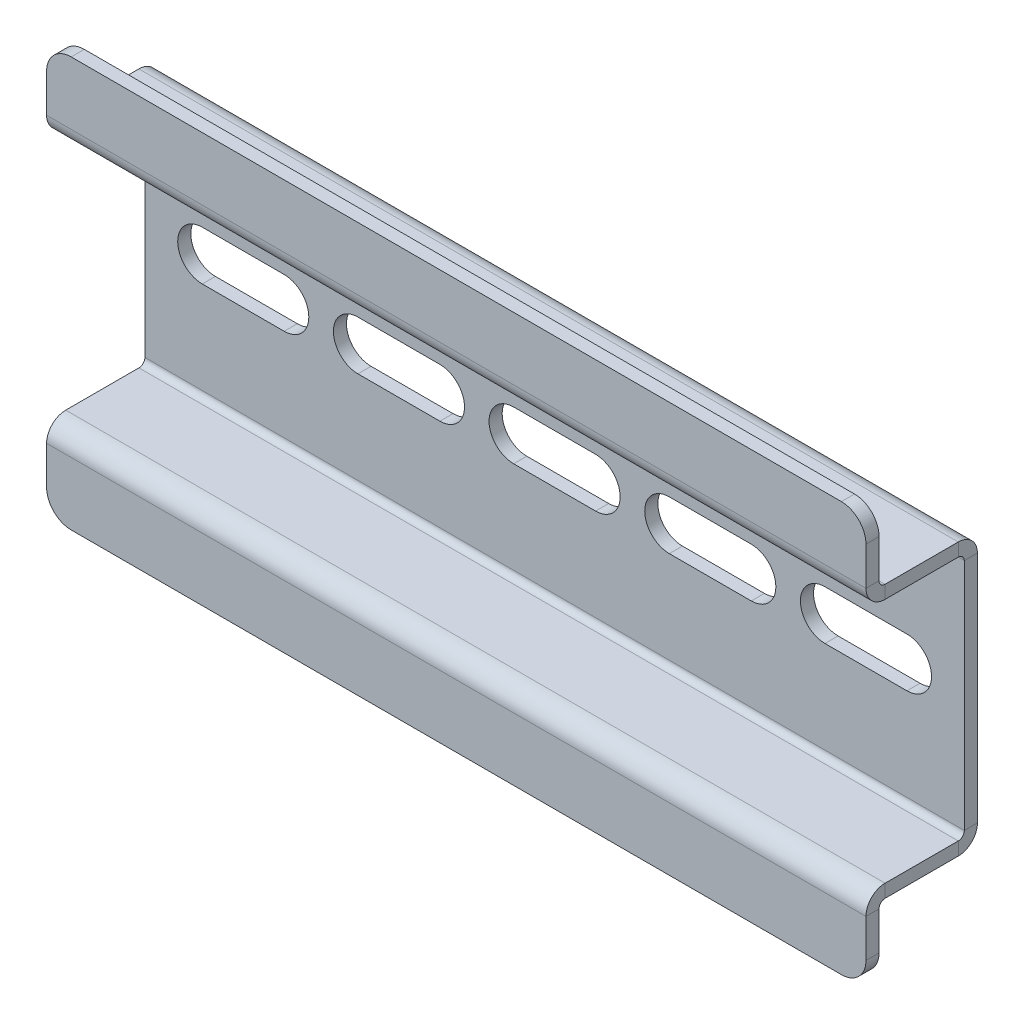
from build123d import *

# Parameters (mm, degrees)
SKETCH_1_W                         = 100
SKETCH_1_H                         = 30
SM_BASE_FLANGE_1_DEPTH             = 1.6
SM_EDGE_FLANGE_1_STRIP_W           = 7.8732
SM_EDGE_FLANGE_1_STRIP_H           = 1.6
SM_EDGE_FLANGE_1_STRIP_CUT_DEPTH   = 100
SM_EDGE_FLANGE_1_STRIP_2_W         = 7.8732
SM_EDGE_FLANGE_1_STRIP_2_H         = 1.6
SM_EDGE_FLANGE_1_STRIP_CUT_2_DEPTH = 100
SM_EDGE_FLANGE_1_DEPTH             = 100
SM_EDGE_FLANGE_1_BEND_DEPTH        = 100
SM_EDGE_FLANGE_2_STRIP_W           = 7.8732
SM_EDGE_FLANGE_2_STRIP_H           = 1.6
SM_EDGE_FLANGE_2_STRIP_CUT_DEPTH   = 100
SM_EDGE_FLANGE_2_STRIP_2_W         = 7.8732
SM_EDGE_FLANGE_2_STRIP_2_H         = 1.6
SM_EDGE_FLANGE_2_STRIP_CUT_2_DEPTH = 100
SM_EDGE_FLANGE_2_DEPTH             = 100
SM_EDGE_FLANGE_2_BEND_DEPTH        = 100
CUT_EXTRUDE_1_DEPTH                = 58.175169436
CUT_EXTRUDE_2_DEPTH                = 58.532251825


# Sheet-metal steps are written as plain solids
with BuildPart() as part:
    # Sketch 1 → 基体-法兰1 (new body)
    with BuildSketch(Plane.XY):
        Rectangle(SKETCH_1_W, SKETCH_1_H)
    extrude(amount=-SM_BASE_FLANGE_1_DEPTH)

    # 边线-法兰1 strip (across the edge) → 边线-法兰1 strip cut (cut)
    with BuildSketch(Plane(origin=(50, 15, 0), x_dir=(0, -1, 0), z_dir=(-1, 0, 0))):
        with Locations((-3.2, -0.8)):
            Rectangle(SM_EDGE_FLANGE_1_STRIP_W, SM_EDGE_FLANGE_1_STRIP_H)
    extrude(amount=SM_EDGE_FLANGE_1_STRIP_CUT_DEPTH, mode=Mode.SUBTRACT)

    # 边线-法兰1 strip 2 (across the edge) → 边线-法兰1 strip cut 2 (cut)
    with BuildSketch(Plane(origin=(-50, -15, 0), x_dir=(0, 1, 0), z_dir=(1, 0, 0))):
        with Locations((-3.2, -0.8)):
            Rectangle(SM_EDGE_FLANGE_1_STRIP_2_W, SM_EDGE_FLANGE_1_STRIP_2_H)
    extrude(amount=SM_EDGE_FLANGE_1_STRIP_CUT_2_DEPTH, mode=Mode.SUBTRACT)

    # 边线-法兰1 section (across the edge) → 边线-法兰1 (add)
    with BuildSketch(Plane(origin=(50, 15, 0), x_dir=(0, -1, 0), z_dir=(-1, 0, 0))):
        with BuildLine():
            Line((-1.6, 0.7366), (-1.6, 10.4))
            Line((-1.6, 10.4), (0, 10.4))
            Line((0, 10.4), (0, 0.7366))
            ThreePointArc((0, 0.7366), (0.215745145, 0.215745145), (0.7366, 0))
            Line((0.7366, 0), (0.7366, -1.6))
            ThreePointArc((0.7366, -1.6), (-0.915625705, -0.915625705), (-1.6, 0.7366))
        make_face()
    extrude(amount=SM_EDGE_FLANGE_1_DEPTH)

    # 边线-法兰1 section 2 (across the edge) → 边线-法兰1 bend (add)
    with BuildSketch(Plane(origin=(-50, -15, 0), x_dir=(0, 1, 0), z_dir=(1, 0, 0))):
        with BuildLine():
            Line((-1.6, 0.7366), (-1.6, 10.4))
            Line((-1.6, 10.4), (0, 10.4))
            Line((0, 10.4), (0, 0.7366))
            ThreePointArc((0, 0.7366), (0.215745145, 0.215745145), (0.7366, 0))
            Line((0.7366, 0), (0.7366, -1.6))
            ThreePointArc((0.7366, -1.6), (-0.915625705, -0.915625705), (-1.6, 0.7366))
        make_face()
    extrude(amount=SM_EDGE_FLANGE_1_BEND_DEPTH)

    # 边线-法兰2 strip (across the edge) → 边线-法兰2 strip cut (cut)
    with BuildSketch(Plane(origin=(-50, 16.6, 10.4), x_dir=(0, 0, -1), z_dir=(1, 0, 0))):
        with Locations((-3.2, -0.8)):
            Rectangle(SM_EDGE_FLANGE_2_STRIP_W, SM_EDGE_FLANGE_2_STRIP_H)
    extrude(amount=SM_EDGE_FLANGE_2_STRIP_CUT_DEPTH, mode=Mode.SUBTRACT)

    # 边线-法兰2 strip 2 (across the edge) → 边线-法兰2 strip cut 2 (cut)
    with BuildSketch(Plane(origin=(50, -16.6, 10.4), x_dir=(0, 0, -1), z_dir=(-1, 0, 0))):
        with Locations((-3.2, -0.8)):
            Rectangle(SM_EDGE_FLANGE_2_STRIP_2_W, SM_EDGE_FLANGE_2_STRIP_2_H)
    extrude(amount=SM_EDGE_FLANGE_2_STRIP_CUT_2_DEPTH, mode=Mode.SUBTRACT)

    # 边线-法兰2 section (across the edge) → 边线-法兰2 (add)
    with BuildSketch(Plane(origin=(-50, 16.6, 10.4), x_dir=(0, 0, -1), z_dir=(1, 0, 0))):
        with BuildLine():
            Line((-1.6, 0.7366), (-1.6, 8.4))
            Line((-1.6, 8.4), (0, 8.4))
            Line((0, 8.4), (0, 0.7366))
            ThreePointArc((0, 0.7366), (0.215745145, 0.215745145), (0.7366, 0))
            Line((0.7366, 0), (0.7366, -1.6))
            ThreePointArc((0.7366, -1.6), (-0.915625705, -0.915625705), (-1.6, 0.7366))
        make_face()
    extrude(amount=SM_EDGE_FLANGE_2_DEPTH)

    # 边线-法兰2 section 2 (across the edge) → 边线-法兰2 bend (add)
    with BuildSketch(Plane(origin=(50, -16.6, 10.4), x_dir=(0, 0, -1), z_dir=(-1, 0, 0))):
        with BuildLine():
            Line((-1.6, 0.7366), (-1.6, 8.4))
            Line((-1.6, 8.4), (0, 8.4))
            Line((0, 8.4), (0, 0.7366))
            ThreePointArc((0, 0.7366), (0.215745145, 0.215745145), (0.7366, 0))
            Line((0.7366, 0), (0.7366, -1.6))
            ThreePointArc((0.7366, -1.6), (-0.915625705, -0.915625705), (-1.6, 0.7366))
        make_face()
    extrude(amount=SM_EDGE_FLANGE_2_BEND_DEPTH)

    # 草图18 → 切除-拉伸1 (cut, through all)
    with BuildSketch(Plane.XY):
        with BuildLine():
            Line((50, 25), (47, 25))
            ThreePointArc((47, 25), (49.121320344, 24.121320344), (50, 22))
            Line((50, 22), (50, 25))
        make_face()
        with BuildLine():
            Line((-47, 25), (-50, 25))
            Line((-50, 25), (-50, 22))
            ThreePointArc((-50, 22), (-49.121320344, 24.121320344), (-47, 25))
        make_face()
        with BuildLine():
            Line((-50, -22), (-50, -25))
            Line((-50, -25), (-47, -25))
            ThreePointArc((-47, -25), (-49.121320344, -24.121320344), (-50, -22))
        make_face()
        with BuildLine():
            Line((47, -25), (50, -25))
            Line((50, -25), (50, -22))
            ThreePointArc((50, -22), (49.121320344, -24.121320344), (47, -25))
        make_face()
    extrude(amount=CUT_EXTRUDE_1_DEPTH, mode=Mode.SUBTRACT)

    # 草图19 → 切除-拉伸2 (cut, through all)
    with BuildSketch(Plane(origin=(0, 0, -1.6), x_dir=(-1, 0, 0), z_dir=(0, 0, -1))):
        with BuildLine():
            Line((-43, 3), (-33, 3))
            ThreePointArc((-33, 3), (-30, 0), (-33, -3))
            Line((-33, -3), (-43, -3))
            ThreePointArc((-43, -3), (-46, 0), (-43, 3))
        make_face()
        with BuildLine():
            Line((-24, 3), (-14, 3))
            ThreePointArc((-14, 3), (-11, 0), (-14, -3))
            Line((-14, -3), (-24, -3))
            ThreePointArc((-24, -3), (-27, 0), (-24, 3))
        make_face()
        with BuildLine():
            Line((-5, 3), (5, 3))
            ThreePointArc((5, 3), (8, 0), (5, -3))
            Line((5, -3), (-5, -3))
            ThreePointArc((-5, -3), (-8, 0), (-5, 3))
        make_face()
        with BuildLine():
            Line((14, 3), (24, 3))
            ThreePointArc((24, 3), (27, 0), (24, -3))
            Line((24, -3), (14, -3))
            ThreePointArc((14, -3), (11, 0), (14, 3))
        make_face()
        with BuildLine():
            Line((33, 3), (43, 3))
            ThreePointArc((43, 3), (46, 0), (43, -3))
            Line((43, -3), (33, -3))
            ThreePointArc((33, -3), (30, 0), (33, 3))
        make_face()
    extrude(amount=-CUT_EXTRUDE_2_DEPTH, mode=Mode.SUBTRACT)


solid = part.part
